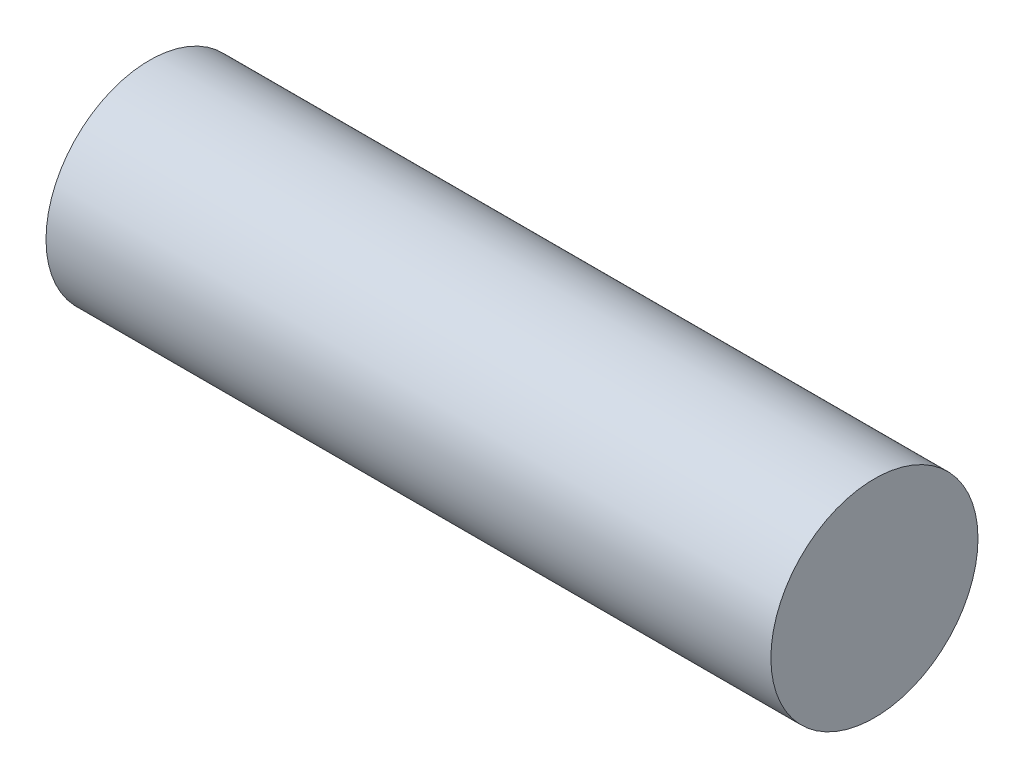
from build123d import *

# Parameters (mm, degrees)
SKETCH1_R           = 6.35
BOSS_EXTRUDE1_DEPTH = 22.225


with BuildPart() as part:
    # Sketch1 → Boss-Extrude1 (new, symmetric)
    with BuildSketch(Plane(origin=(0, 0, 0), x_dir=(0, 0, -1), z_dir=(1, 0, 0))):
        Circle(SKETCH1_R)
    extrude(amount=BOSS_EXTRUDE1_DEPTH, both=True)


solid = part.part
